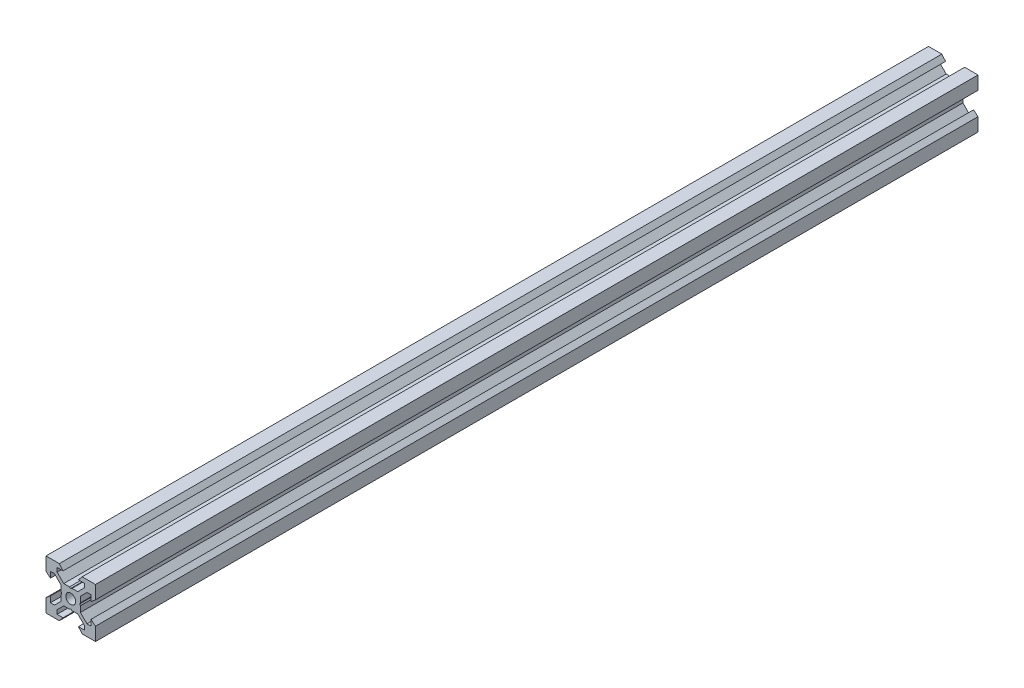
from build123d import *

# Parameters (mm, degrees)
SKETCH1_R           = 2
BOSS_EXTRUDE1_DEPTH = 178.345


with BuildPart() as part:
    # Sketch1 → Boss-Extrude1 (new, symmetric)
    with BuildSketch(Plane.XY):
        Polygon((10, 4.610379336), (10, 10), (4.610379336, 10), (3.1, 8.2), (5.5, 8.2), (5.5, 6.560660172), (2.839339828, 3.9), (0.519615242, 3.9), (0, 3.6), (-0.519615242, 3.9), (-2.839339828, 3.9), (-5.5, 6.560660172), (-5.5, 8.2), (-3.1, 8.2), (-4.610379336, 10), (-10, 10), (-10, 4.610379336), (-8.2, 3.1), (-8.2, 5.5), (-6.560660172, 5.5), (-3.9, 2.839339828), (-3.9, 0.519615242), (-3.6, 0), (-3.9, -0.519615242), (-3.9, -2.839339828), (-6.560660172, -5.5), (-8.2, -5.5), (-8.2, -3.1), (-10, -4.610379336), (-10, -10), (-4.610379336, -10), (-3.1, -8.2), (-5.5, -8.2), (-5.5, -6.560660172), (-2.839339828, -3.9), (-0.519615242, -3.9), (0, -3.6), (0.519615242, -3.9), (2.839339828, -3.9), (5.5, -6.560660172), (5.5, -8.2), (3.1, -8.2), (4.610379336, -10), (10, -10), (10, -4.610379336), (8.2, -3.1), (8.2, -5.5), (6.560660172, -5.5), (3.9, -2.839339828), (3.9, -0.519615242), (3.6, 0), (3.9, 0.519615242), (3.9, 2.839339828), (6.560660172, 5.5), (8.2, 5.5), (8.2, 3.1), align=None)
        Circle(SKETCH1_R, mode=Mode.SUBTRACT)
    extrude(amount=BOSS_EXTRUDE1_DEPTH, both=True)


solid = part.part
